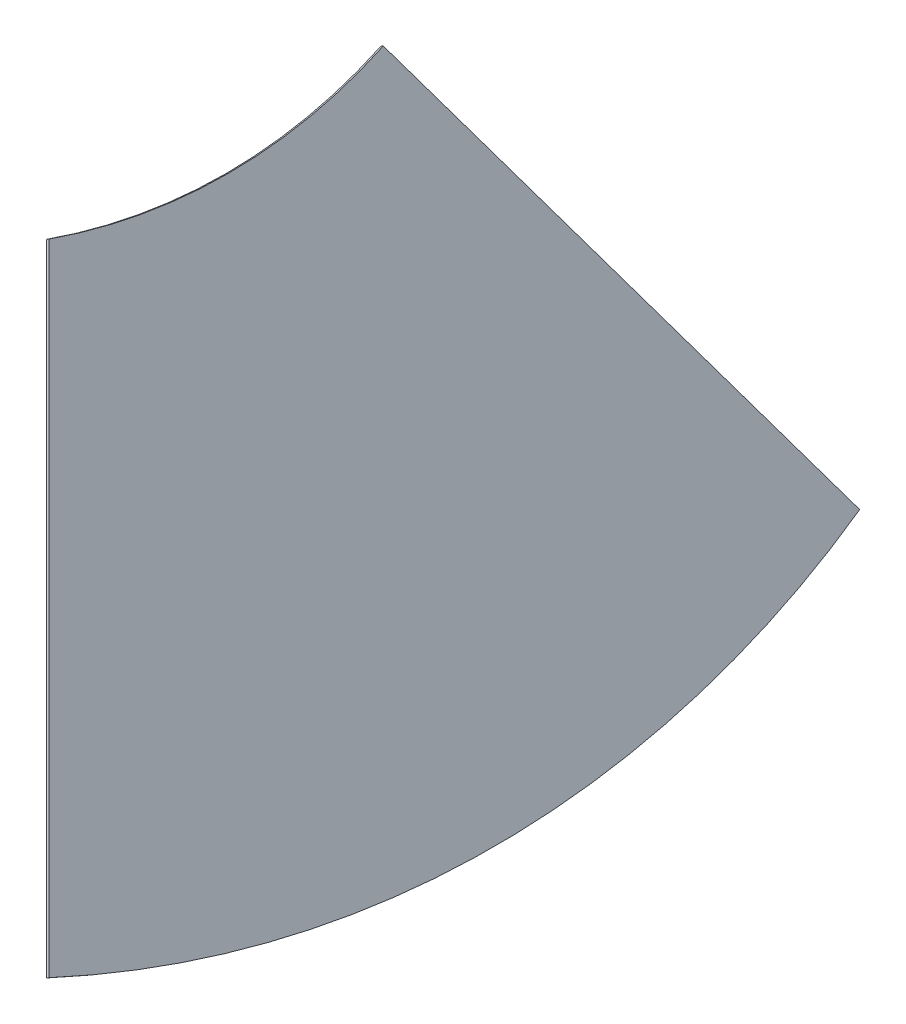
from build123d import *

# Parameters (mm, degrees)
BOSS_EXTRUDE1_DEPTH = 0.635


with BuildPart() as part:
    # Sketch2 → Boss-Extrude1 (new, symmetric)
    with BuildSketch(Plane(origin=(18.200175652, 56.041874627, 84.504712269), x_dir=(-0.36177639344462836, 0.6097357967348671, 0.7052234392916152), z_dir=(-0.860012120645903, -0.5102736053747408, -1.0283468074398178e-15))):
        with BuildLine():
            ThreePointArc((-87.00462748, -70.882710113), (-146.22686407, -26.25993014), (-190.533962086, 33.198852765))
            Line((-190.533962086, 33.198852765), (-409.507054953, -37.162959321))
            ThreePointArc((-409.507054953, -37.162959321), (-308.800787065, -187.971280416), (-158.530337284, -289.478393596))
            Line((-158.530337284, -289.478393596), (-87.00462748, -70.882710113))
        make_face()
    extrude(amount=BOSS_EXTRUDE1_DEPTH, both=True)


solid = part.part
